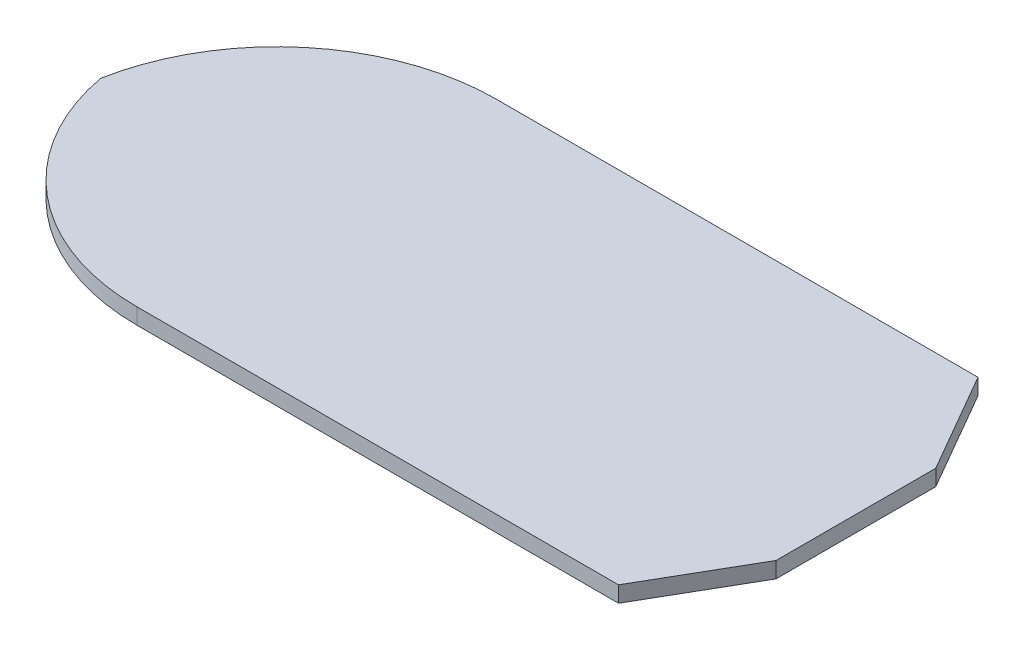
from build123d import *

# Parameters (mm, degrees)
ESQUISSE1_W        = 190
ESQUISSE1_H        = 90
BOSS_EXTRU_1_DEPTH = 4
CONG_1_R           = 55
CHANFREIN1_SIZE    = 25
CHANFREIN1_SIZE2   = 14.43375673


with BuildPart() as part:
    # Esquisse1 → Boss.-Extru.1 (new body)
    with BuildSketch(Plane(origin=(0, 0, 0), x_dir=(1, 0, 0), z_dir=(0, 1, 0))):
        Rectangle(ESQUISSE1_W, ESQUISSE1_H)
    extrude(amount=BOSS_EXTRU_1_DEPTH)

    # Congé1
    # the kernel refuses this fillet: 55 mm, written as the material it takes off along each edge
    with BuildSketch(Plane(origin=(-95, -137.5, 45), x_dir=(1, 0, 0), z_dir=(0, 1, 0))) as cong_1_piece_1:
        with BuildLine():
            CenterArc((CONG_1_R, CONG_1_R), CONG_1_R, 180, 90)
            Line((0, CONG_1_R), (0, 0))
            Line((0, 0), (CONG_1_R, 0))
        make_face()
    extrude(amount=279, mode=Mode.SUBTRACT)
    with BuildSketch(Plane(origin=(-95, -137.5, -45), x_dir=(1, 0, 0), z_dir=(0, 1, 0))) as cong_1_piece_2:
        with BuildLine():
            CenterArc((CONG_1_R, -CONG_1_R), CONG_1_R, 90, 90)
            Line((0, -CONG_1_R), (0, 0))
            Line((0, 0), (CONG_1_R, 0))
        make_face()
    extrude(amount=279, mode=Mode.SUBTRACT)

    # Chanfrein1
    chanfrein1_edges = [part.edges().sort_by_distance(p)[0] for p in [
        (95, 2, 45),
        (95, 2, -45),
    ]]
    chanfrein1_side = [part.faces().sort_by_distance(p)[0] for p in [
        (95, 2, 0),
    ]]
    chamfer(chanfrein1_edges, length=CHANFREIN1_SIZE, length2=CHANFREIN1_SIZE2, reference=chanfrein1_side[0])


solid = part.part
